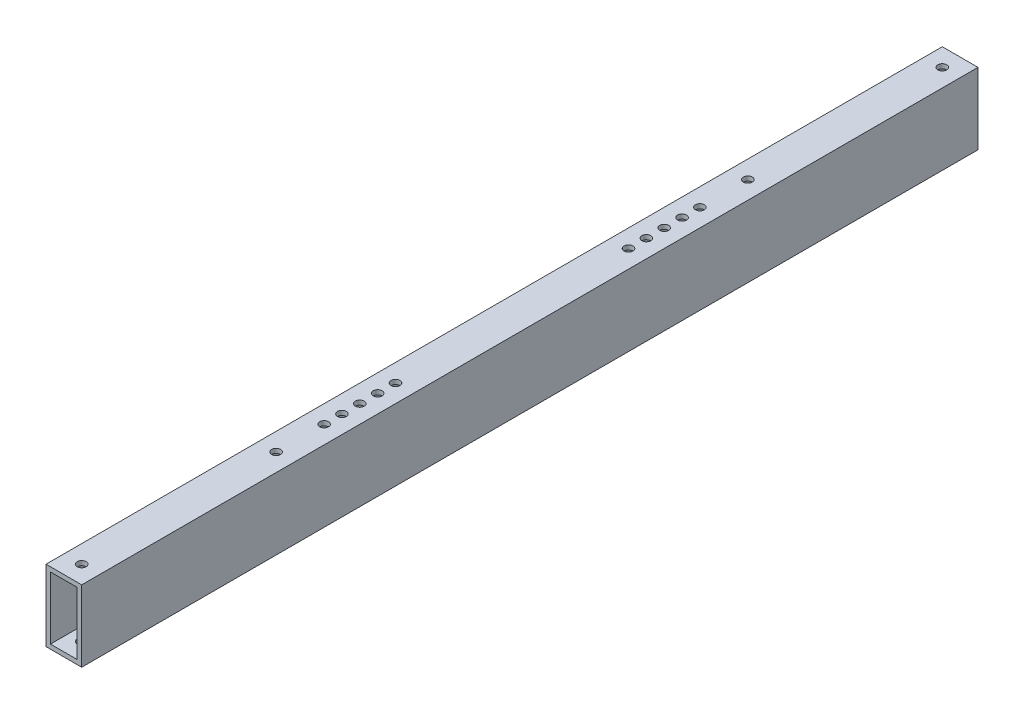
from build123d import *

# Parameters (mm, degrees)
SKETCH1_W           = 25.4
SKETCH1_H           = 50.8
SKETCH1_W_2         = 19.05
SKETCH1_H_2         = 44.45
BOSS_EXTRUDE1_DEPTH = 637.54
SKETCH2_R           = 3.175
CUT_EXTRUDE1_DEPTH  = 640.686783981


with BuildPart() as part:
    # Sketch1 → Boss-Extrude1 (new body)
    with BuildSketch(Plane.XY):
        Rectangle(SKETCH1_W, SKETCH1_H)
        Rectangle(SKETCH1_W_2, SKETCH1_H_2, mode=Mode.SUBTRACT)
    extrude(amount=BOSS_EXTRUDE1_DEPTH)

    # Sketch2 → Cut-Extrude1 (cut, through all)
    with BuildSketch(Plane(origin=(0, 25.4, 0), x_dir=(1, 0, 0), z_dir=(0, 1, 0))):
        with Locations((0, -12.7)):
            Circle(SKETCH2_R)
        with Locations((0, -151.012144)):
            Circle(SKETCH2_R)
        with Locations((0, -486.527856)):
            Circle(SKETCH2_R)
        with Locations((0, -624.84)):
            Circle(SKETCH2_R)
        with Locations((0, -185.1062846)):
            Circle(SKETCH2_R)
        with Locations((0, -197.8062846)):
            Circle(SKETCH2_R)
        with Locations((0, -210.5062846)):
            Circle(SKETCH2_R)
        with Locations((0, -223.2062846)):
            Circle(SKETCH2_R)
        with Locations((0, -235.9062846)):
            Circle(SKETCH2_R)
        with Locations((0, -401.6337154)):
            Circle(SKETCH2_R)
        with Locations((0, -414.3337154)):
            Circle(SKETCH2_R)
        with Locations((0, -427.0337154)):
            Circle(SKETCH2_R)
        with Locations((0, -439.7337154)):
            Circle(SKETCH2_R)
        with Locations((0, -452.4337154)):
            Circle(SKETCH2_R)
    extrude(amount=-CUT_EXTRUDE1_DEPTH, mode=Mode.SUBTRACT)


solid = part.part
